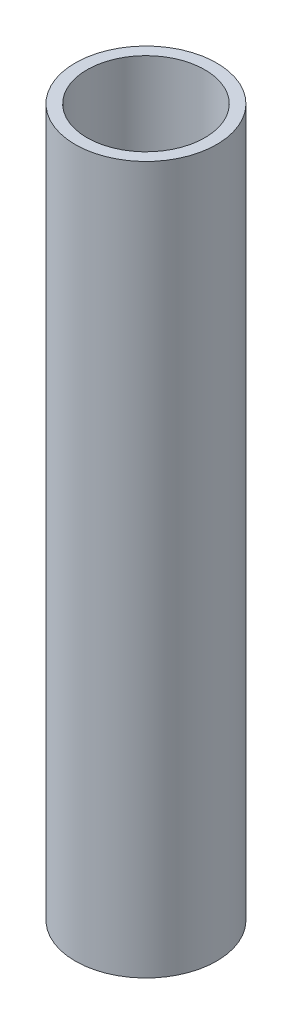
from build123d import *

# Parameters (mm, degrees)
SKETCH1_R           = 30
SKETCH1_R_2         = 25
BOSS_EXTRUDE1_DEPTH = 300


with BuildPart() as part:
    # Sketch1 → Boss-Extrude1 (new body)
    with BuildSketch(Plane(origin=(0, 0, 0), x_dir=(1, 0, 0), z_dir=(0, 1, 0))):
        Circle(SKETCH1_R)
        Circle(SKETCH1_R_2, mode=Mode.SUBTRACT)
    extrude(amount=BOSS_EXTRUDE1_DEPTH)


solid = part.part
